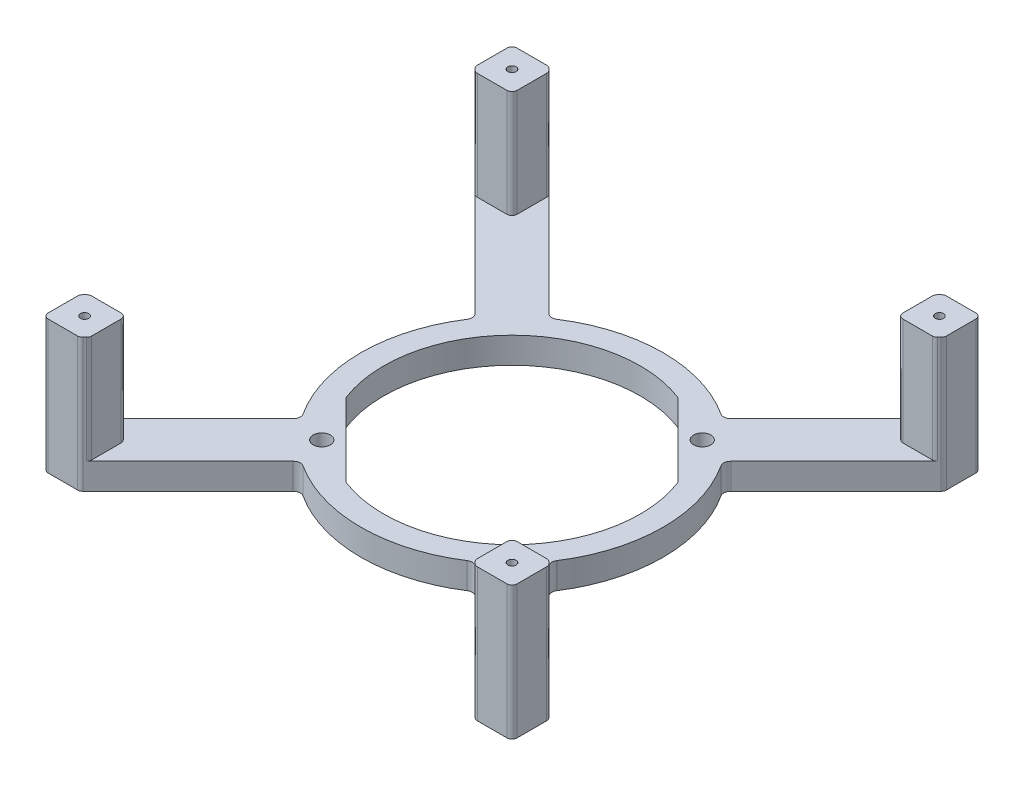
from build123d import *

# Parameters (mm, degrees)
BOSS_EXTRUDE1_DEPTH         = 5
TAP_DRILL_FOR_M4X0_7_TAP1_D = 3.3
BOSS_EXTRUDE2_DEPTH         = 20.6
CIRPATTERN1_COUNT           = 4


with BuildPart() as part:
    # Sketch1 → Boss-Extrude1 (new body)
    with BuildSketch(Plane(origin=(0, 0, 0), x_dir=(1, 0, 0), z_dir=(0, 1, 0))):
        with BuildLine():
            Line((6, 95), (11.656854249, 95))
            ThreePointArc((11.656854249, 95), (12.039537682, 94.923879533), (12.363961031, 94.707106781))
            Line((12.363961031, 94.707106781), (32.538709783, 74.532358029))
            ThreePointArc((32.538709783, 74.532358029), (33.362638794, 74.138893326), (34.250764856, 74.350802705))
            ThreePointArc((34.250764856, 74.350802705), (50, 79), (65.749235144, 74.350802705))
            ThreePointArc((65.749235144, 74.350802705), (66.637361206, 74.138893326), (67.461290217, 74.532358029))
            Line((67.461290217, 74.532358029), (87.636038969, 94.707106781))
            ThreePointArc((87.636038969, 94.707106781), (87.960462318, 94.923879533), (88.343145751, 95))
            Line((88.343145751, 95), (94, 95))
            ThreePointArc((94, 95), (94.707106781, 94.707106781), (95, 94))
            Line((95, 94), (95, 88.343145751))
            ThreePointArc((95, 88.343145751), (94.923879533, 87.960462318), (94.707106781, 87.636038969))
            Line((94.707106781, 87.636038969), (74.532358029, 67.461290217))
            ThreePointArc((74.532358029, 67.461290217), (74.138893326, 66.637361206), (74.350802705, 65.749235144))
            ThreePointArc((74.350802705, 65.749235144), (79, 50), (74.350802705, 34.250764856))
            ThreePointArc((74.350802705, 34.250764856), (74.138893326, 33.362638794), (74.532358029, 32.538709783))
            Line((74.532358029, 32.538709783), (94.707106781, 12.363961031))
            ThreePointArc((94.707106781, 12.363961031), (94.923879533, 12.039537682), (95, 11.656854249))
            Line((95, 11.656854249), (95, 6))
            ThreePointArc((95, 6), (94.707106781, 5.292893219), (94, 5))
            Line((94, 5), (88.343145751, 5))
            ThreePointArc((88.343145751, 5), (87.960462318, 5.076120467), (87.636038969, 5.292893219))
            Line((87.636038969, 5.292893219), (67.461290217, 25.467641971))
            ThreePointArc((67.461290217, 25.467641971), (66.637361206, 25.861106674), (65.749235144, 25.649197295))
            ThreePointArc((65.749235144, 25.649197295), (50, 21), (34.250764856, 25.649197295))
            ThreePointArc((34.250764856, 25.649197295), (33.362638794, 25.861106674), (32.538709783, 25.467641971))
            Line((32.538709783, 25.467641971), (12.363961031, 5.292893219))
            ThreePointArc((12.363961031, 5.292893219), (12.039537682, 5.076120467), (11.656854249, 5))
            Line((11.656854249, 5), (6, 5))
            ThreePointArc((6, 5), (5.292893219, 5.292893219), (5, 6))
            Line((5, 6), (5, 11.656854249))
            ThreePointArc((5, 11.656854249), (5.076120467, 12.039537682), (5.292893219, 12.363961031))
            Line((5.292893219, 12.363961031), (25.467641971, 32.538709783))
            ThreePointArc((25.467641971, 32.538709783), (25.861106674, 33.362638794), (25.649197295, 34.250764856))
            ThreePointArc((25.649197295, 34.250764856), (21, 50), (25.649197295, 65.749235144))
            ThreePointArc((25.649197295, 65.749235144), (25.861106674, 66.637361206), (25.467641971, 67.461290217))
            Line((25.467641971, 67.461290217), (5.292893219, 87.636038969))
            ThreePointArc((5.292893219, 87.636038969), (5.076120467, 87.960462318), (5, 88.343145751))
            Line((5, 88.343145751), (5, 94))
            ThreePointArc((5, 94), (5.292893219, 94.707106781), (6, 95))
        make_face()
        with BuildLine():
            Line((72.980970389, 58.838834765), (58.838834765, 72.980970389))
            ThreePointArc((58.838834765, 72.980970389), (32.589514654, 67.410485346), (27.019029611, 41.161165235))
            Line((27.019029611, 41.161165235), (41.161165235, 27.019029611))
            ThreePointArc((41.161165235, 27.019029611), (67.410485346, 32.589514654), (72.980970389, 58.838834765))
        make_face(mode=Mode.SUBTRACT)
    extrude(amount=BOSS_EXTRUDE1_DEPTH)

    # Tap Drill for M4x0.7 Tap1 (through all)
    with Locations(Plane(origin=(31.749573978, 5, -31.749573978), x_dir=(0, 0, 1), z_dir=(0, 1, 0))):
        with Locations((0, 0), (-36.500852044, 36.500852044)):
            Hole(TAP_DRILL_FOR_M4X0_7_TAP1_D / 2)

    # Sketch6 → Boss-Extrude2 (add)
    with BuildSketch(Plane(origin=(0, 5, 0), x_dir=(1, 0, 0), z_dir=(0, 1, 0))):
        with BuildLine():
            Line((6, 95), (11.656854249, 95))
            ThreePointArc((11.656854249, 95), (12.039537682, 94.923879533), (12.363961031, 94.707106781))
            Line((12.363961031, 94.707106781), (12.707106781, 94.363961031))
            ThreePointArc((12.707106781, 94.363961031), (12.923879533, 94.039537682), (13, 93.656854249))
            Line((13, 93.656854249), (13, 88))
            ThreePointArc((13, 88), (12.707106781, 87.292893219), (12, 87))
            Line((12, 87), (6.343145751, 87))
            ThreePointArc((6.343145751, 87), (5.960462318, 87.076120467), (5.636038969, 87.292893219))
            Line((5.636038969, 87.292893219), (5.292893219, 87.636038969))
            ThreePointArc((5.292893219, 87.636038969), (5.076120467, 87.960462318), (5, 88.343145751))
            Line((5, 88.343145751), (5, 94))
            ThreePointArc((5, 94), (5.292893219, 94.707106781), (6, 95))
        make_face()
    boss_extrude2 = extrude(amount=BOSS_EXTRUDE2_DEPTH)

    # Sketch9 → Tap Drill for M2x0.4 Tap1 (revolve, cut)
    with BuildSketch(Plane(origin=(9, 25.6, -91), x_dir=(0, 0, 1), z_dir=(1, 0, 0))):
        Polygon((0, 0), (0, 4.480688495), (0.8, 4), (0.8, 0), align=None)
    tap_drill_for_m2x0_4_tap1 = revolve(axis=Axis((9, 31.95, -91), (0, -1, 0)), mode=Mode.SUBTRACT)

    # CirPattern1: Boss-Extrude2, Tap Drill for M2x0.4 Tap1 ×4 about axis
    cirpattern1_axis = Axis((50, 5, -50), (0, -1, 0))
    add([boss_extrude2.rotate(cirpattern1_axis, i * 360 / CIRPATTERN1_COUNT) for i in range(1, CIRPATTERN1_COUNT)])
    add([tap_drill_for_m2x0_4_tap1.rotate(cirpattern1_axis, i * 360 / CIRPATTERN1_COUNT) for i in range(1, CIRPATTERN1_COUNT)], mode=Mode.SUBTRACT)


solid = part.part
